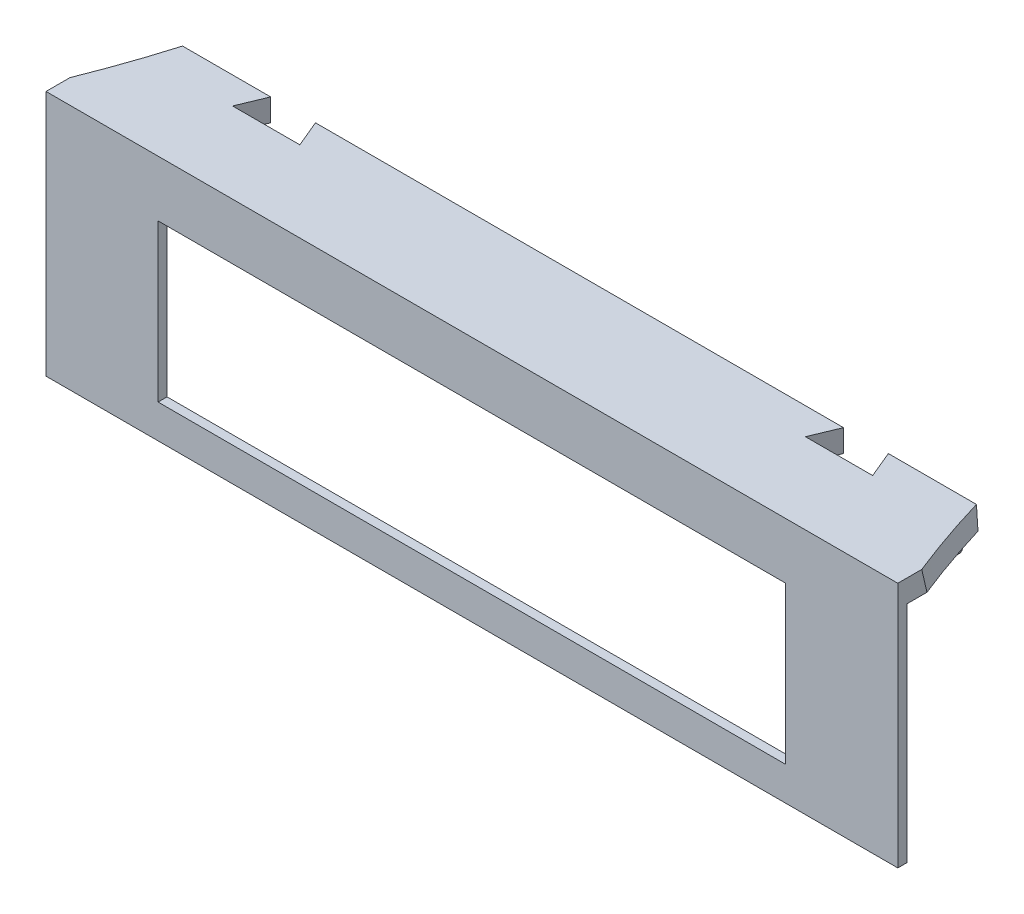
from build123d import *

# Parameters (mm, degrees)
SKETCH1_W                = 190
SKETCH1_H                = 50
SKETCH1_W_2              = 140
SKETCH1_H_2              = 35
BOSS_EXTRUDE1_DEPTH      = 2
SKETCH3_W                = 190
SKETCH3_H                = 5
BOSS_EXTRUDE2_DEPTH      = 24
BOSS_EXTRUDE3_START      = -7.5
SKETCH6_W                = 5
SKETCH6_H                = 5.25
BOSS_EXTRUDE3_DEPTH      = 5.25
CUT_EXTRUDE1_DEPTH       = 108.905945309
SKETCH7_R                = 1.65
CUT_EXTRUDE2_DEPTH       = 5
FILLET1_R                = 2.75
FILLET1_OF_MIRROR3_R     = 2.75
CUT_EXTRUDE3_DEPTH       = 5
SKETCH10_W               = 6
SKETCH10_H               = 6
CUT_EXTRUDE4_DEPTH       = 1.6
CHAMFER1_SIZE            = 1
SKETCH12_W               = 6
SKETCH12_H               = 6
CUT_EXTRUDE5_DEPTH       = 1.6
CHAMFER1_OF_MIRROR5_SIZE = 1


with BuildPart() as part:
    # Sketch1 → Boss-Extrude1 (new body)
    with BuildSketch(Plane.XY):
        Rectangle(SKETCH1_W, SKETCH1_H)
        Rectangle(SKETCH1_W_2, SKETCH1_H_2, mode=Mode.SUBTRACT)
    extrude(amount=BOSS_EXTRUDE1_DEPTH)

    # Sketch3 → Boss-Extrude2 (add)
    with BuildSketch(Plane.XY.offset(2)):
        with Locations((0, 27.5)):
            Rectangle(SKETCH3_W, SKETCH3_H)
    extrude(amount=-BOSS_EXTRUDE2_DEPTH)

    # Sketch6 → Boss-Extrude3 (add)
    with BuildSketch(Plane.ZY.offset(95).offset(BOSS_EXTRUDE3_START)):
        with Locations((-17.5, 22.375)):
            Rectangle(SKETCH6_W, SKETCH6_H)
    boss_extrude3 = extrude(amount=-BOSS_EXTRUDE3_DEPTH)

    # Sketch5 → Cut-Extrude1 (cut, symmetric)
    with BuildSketch(Plane(origin=(0, 18.839521848, 4.396767931), x_dir=(1, 0, 0), z_dir=(0, 0.9738311486761368, 0.22727273014621918))):
        with BuildLine():
            Line((95, 28.242467175), (88.541117044, 28.242467175))
            ThreePointArc((88.541117044, 28.242467175), (91.551341518, 19.077417851), (95, 10.068181746))
            Line((95, 10.068181746), (95, 28.242467175))
        make_face()
    cut_extrude1 = extrude(amount=CUT_EXTRUDE1_DEPTH, both=True, mode=Mode.SUBTRACT)

    # Mirror1: Cut-Extrude1 across plane
    add(cut_extrude1.mirror(Plane(origin=(0, 0, 0), x_dir=(0, 0, 1), z_dir=(1, 0, 0))), mode=Mode.SUBTRACT)

    # Sketch7 → Cut-Extrude2 (cut)
    with BuildSketch(Plane(origin=(0, 0, -20), x_dir=(-1, 0, 0), z_dir=(0, 0, -1))):
        with Locations((84.875, 22.375)):
            Circle(SKETCH7_R)
    cut_extrude2 = extrude(amount=-CUT_EXTRUDE2_DEPTH, mode=Mode.SUBTRACT)

    # Fillet1
    # the kernel refuses this fillet: 2.75 mm, written as the material it takes off along each edge
    with BuildSketch(Plane(origin=(-87.5, 19.75, -8.125), x_dir=(0, 1, 0), z_dir=(0, 0, -1))) as fillet1_piece_1:
        with BuildLine():
            CenterArc((FILLET1_R, FILLET1_R), FILLET1_R, 180, 90)
            Line((0, FILLET1_R), (0, 0))
            Line((0, 0), (FILLET1_R, 0))
        make_face()
    extrude(amount=18.75, mode=Mode.SUBTRACT)
    with BuildSketch(Plane(origin=(-82.25, 19.75, -8.125), x_dir=(0, 1, 0), z_dir=(0, 0, -1))) as fillet1_piece_2:
        with BuildLine():
            CenterArc((FILLET1_R, -FILLET1_R), FILLET1_R, 90, 90)
            Line((0, -FILLET1_R), (0, 0))
            Line((0, 0), (FILLET1_R, 0))
        make_face()
    extrude(amount=18.75, mode=Mode.SUBTRACT)

    # Mirror3: Boss-Extrude3, Cut-Extrude2 across plane
    add(boss_extrude3.mirror(Plane(origin=(0, 0, 0), x_dir=(0, 0, 1), z_dir=(1, 0, 0))))
    add(cut_extrude2.mirror(Plane(origin=(0, 0, 0), x_dir=(0, 0, 1), z_dir=(1, 0, 0))), mode=Mode.SUBTRACT)

    # Fillet1 of Mirror3
    # the kernel refuses this fillet: 2.75 mm, written as the material it takes off along each edge
    with BuildSketch(Plane(origin=(87.5, 19.75, -8.125), x_dir=(0, 1, 0), z_dir=(0, 0, -1))) as fillet1_of_mirror3_piece_1:
        with BuildLine():
            CenterArc((FILLET1_OF_MIRROR3_R, -FILLET1_OF_MIRROR3_R), FILLET1_OF_MIRROR3_R, 90, 90)
            Line((0, -FILLET1_OF_MIRROR3_R), (0, 0))
            Line((0, 0), (FILLET1_OF_MIRROR3_R, 0))
        make_face()
    extrude(amount=18.75, mode=Mode.SUBTRACT)
    with BuildSketch(Plane(origin=(82.25, 19.75, -8.125), x_dir=(0, 1, 0), z_dir=(0, 0, -1))) as fillet1_of_mirror3_piece_2:
        with BuildLine():
            CenterArc((FILLET1_OF_MIRROR3_R, FILLET1_OF_MIRROR3_R), FILLET1_OF_MIRROR3_R, 180, 90)
            Line((0, FILLET1_OF_MIRROR3_R), (0, 0))
            Line((0, 0), (FILLET1_OF_MIRROR3_R, 0))
        make_face()
    extrude(amount=18.75, mode=Mode.SUBTRACT)

    # Sketch9 → Cut-Extrude3 (cut)
    with BuildSketch(Plane.XZ.offset(-25)):
        Polygon((-68.887905516, -22), (-71.387905516, -16), (-56.387905516, -16), (-58.887905516, -22), align=None)
    cut_extrude3 = extrude(amount=-CUT_EXTRUDE3_DEPTH, mode=Mode.SUBTRACT)

    # Mirror4: Cut-Extrude3 across plane
    add(cut_extrude3.mirror(Plane(origin=(0, 0, 0), x_dir=(0, 0, 1), z_dir=(1, 0, 0))), mode=Mode.SUBTRACT)

    # Sketch10 → Cut-Extrude4 (cut)
    with BuildSketch(Plane(origin=(0, 0, 0), x_dir=(-1, 0, 0), z_dir=(0, 0, -1))):
        with Locations((84.875, 22)):
            Rectangle(SKETCH10_W, SKETCH10_H)
    cut_extrude4 = extrude(amount=-CUT_EXTRUDE4_DEPTH, mode=Mode.SUBTRACT)

    # Chamfer1
    chamfer1_edges = [part.edges().sort_by_distance(p)[0] for p in [
        (-81.875, 22, 0),
        (-84.875, 19, 0),
        (-87.875, 22, 0),
    ]]
    chamfer(chamfer1_edges, length=CHAMFER1_SIZE)

    # Sketch12 → Cut-Extrude5 (cut)
    with BuildSketch(Plane(origin=(0, 0, 0), x_dir=(-1, 0, 0), z_dir=(0, 0, -1))):
        with Locations((-84.875, -22)):
            Rectangle(SKETCH12_W, SKETCH12_H)
    cut_extrude5 = extrude(amount=-CUT_EXTRUDE5_DEPTH, mode=Mode.SUBTRACT)

    # Mirror5: Cut-Extrude4, Cut-Extrude5 across plane
    add(cut_extrude4.mirror(Plane(origin=(0, 0, 0), x_dir=(0, 0, 1), z_dir=(1, 0, 0))), mode=Mode.SUBTRACT)
    add(cut_extrude5.mirror(Plane(origin=(0, 0, 0), x_dir=(0, 0, 1), z_dir=(1, 0, 0))), mode=Mode.SUBTRACT)

    # Chamfer1 of Mirror5
    chamfer1_of_mirror5_edges = [part.edges().sort_by_distance(p)[0] for p in [
        (81.875, 22, 0),
        (84.875, 19, 0),
        (87.875, 22, 0),
    ]]
    chamfer(chamfer1_of_mirror5_edges, length=CHAMFER1_OF_MIRROR5_SIZE)


solid = part.part
